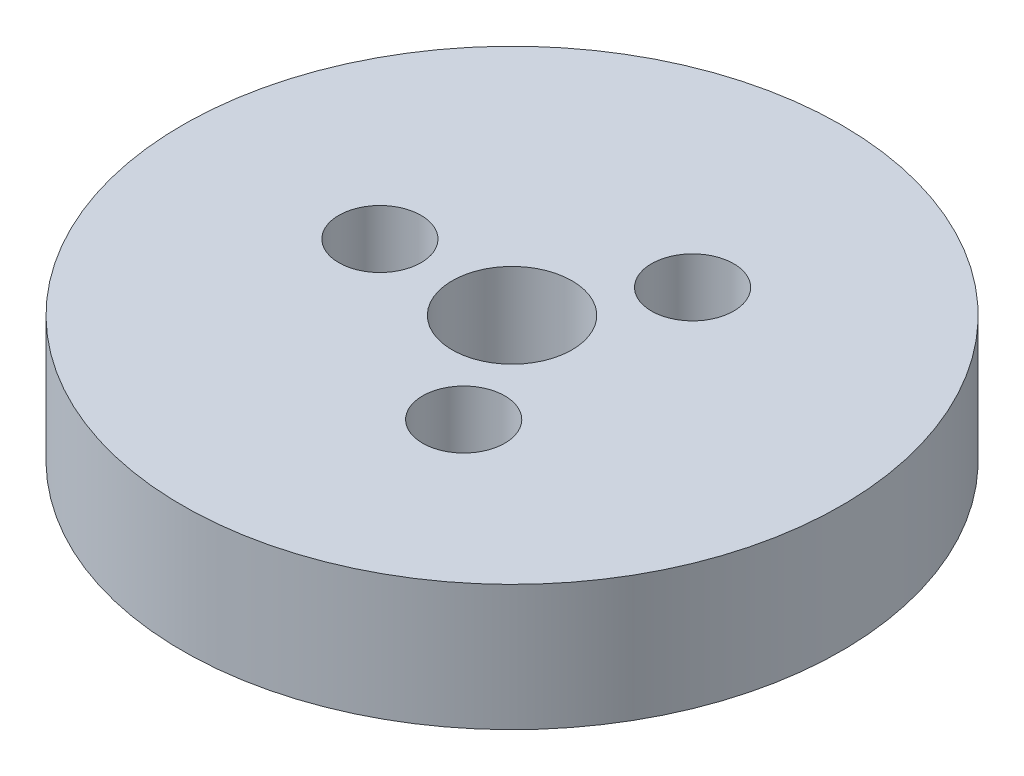
from build123d import *

# Parameters (mm, degrees)
SKETCH1_R           = 55
BOSS_EXTRUDE1_DEPTH = 21
SKETCH2_R           = 10
CUT_EXTRUDE1_DEPTH  = 81.566742518
SKETCH3_R           = 6.858319798
CUT_EXTRUDE2_DEPTH  = 15.610584994
CIRPATTERN1_COUNT   = 3


with BuildPart() as part:
    # Sketch1 → Boss-Extrude1 (new body)
    with BuildSketch(Plane(origin=(0, 0, 0), x_dir=(1, 0, 0), z_dir=(0, 1, 0))):
        Circle(SKETCH1_R)
    extrude(amount=BOSS_EXTRUDE1_DEPTH)

    # Sketch2 → Cut-Extrude1 (cut, through all)
    with BuildSketch(Plane(origin=(0, 0, 0), x_dir=(1, 0, 0), z_dir=(0, 1, 0))):
        Circle(SKETCH2_R)
    extrude(amount=CUT_EXTRUDE1_DEPTH, mode=Mode.SUBTRACT)

    # Sketch3 → Cut-Extrude2 (cut)
    with BuildSketch(Plane(origin=(0, 21, 0), x_dir=(1, 0, 0), z_dir=(0, 1, 0))):
        with Locations((-22.053692068, 0)):
            Circle(SKETCH3_R)
    cut_extrude2 = extrude(amount=-CUT_EXTRUDE2_DEPTH, mode=Mode.SUBTRACT)

    # CirPattern1: Cut-Extrude2 ×3 about axis
    cirpattern1_axis = Axis((0, 0, 0), (0, 1, 0))
    for i in range(1, CIRPATTERN1_COUNT):
        add(cut_extrude2.rotate(cirpattern1_axis, i * 360 / CIRPATTERN1_COUNT), mode=Mode.SUBTRACT)


solid = part.part
